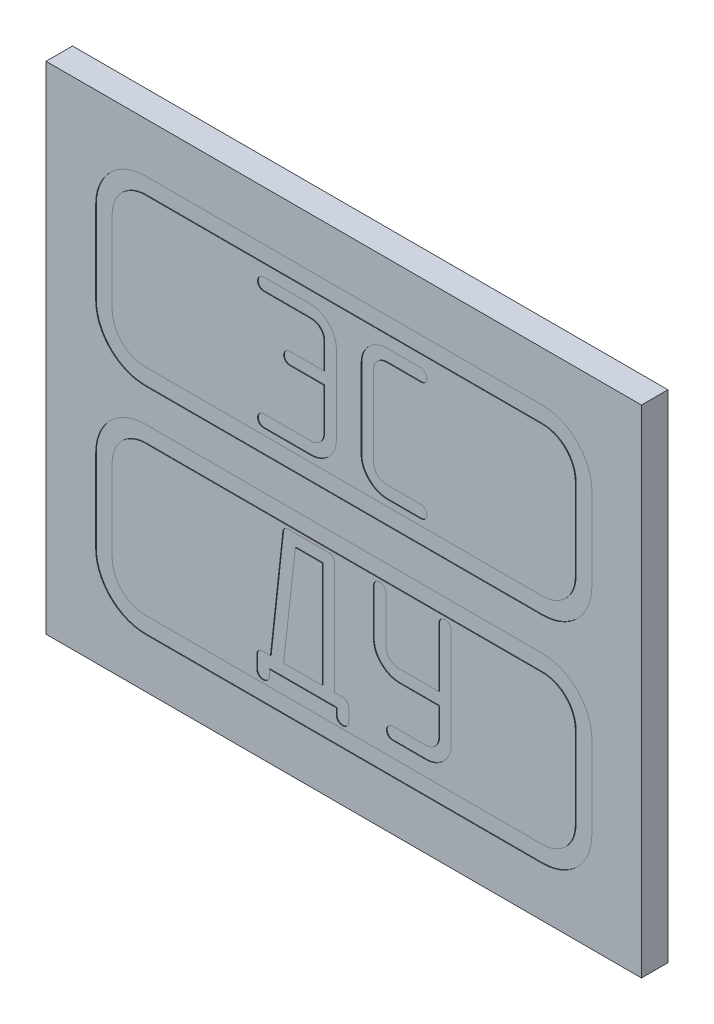
from build123d import *

# Parameters (mm, degrees)
SKETCH_1_W               = 18
SKETCH_1_H               = 15
EXTRUDE_1_DEPTH          = 0.8
CUT_EXTRUDE_1_DEPTH      = 0.02
CUT_EXTRUDE_1_DEPTH_BACK = 0.02
CUT_EXTRUDE_1_2_DEPTH    = 0.02
CUT_EXTRUDE_2_DEPTH      = 0.02
CUT_EXTRUDE_2_DEPTH_BACK = 0.02


with BuildPart() as part:
    # Эскиз1 → Вытянуть1 (new body)
    with BuildSketch(Plane.XY):
        Rectangle(SKETCH_1_W, SKETCH_1_H)
    extrude(amount=EXTRUDE_1_DEPTH)

    # Эскиз2 → Cut-Extrude 1 (cut, two sides: drawn at the far end of the back side and taken through both)
    with BuildSketch(Plane.XY.offset(0.8).offset(-CUT_EXTRUDE_1_DEPTH_BACK)):
        with BuildLine():
            Line((-6, 0.5), (6, 0.5))
            ThreePointArc((6, 0.5), (7.060660172, 0.939339828), (7.5, 2))
            Line((7.5, 2), (7.5, 4.5))
            ThreePointArc((7.5, 4.5), (7.060660172, 5.560660172), (6, 6))
            Line((6, 6), (-6, 6))
            ThreePointArc((-6, 6), (-7.060660172, 5.560660172), (-7.5, 4.5))
            Line((-7.5, 4.5), (-7.5, 2))
            ThreePointArc((-7.5, 2), (-7.060660172, 0.939339828), (-6, 0.5))
        make_face()
        with BuildLine():
            Line((-6, 1), (6, 1))
            ThreePointArc((6, 1), (6.707106781, 1.292893219), (7, 2))
            Line((7, 2), (7, 4.5))
            ThreePointArc((7, 4.5), (6.707106781, 5.207106781), (6, 5.5))
            Line((6, 5.5), (-6, 5.5))
            ThreePointArc((-6, 5.5), (-6.707106781, 5.207106781), (-7, 4.5))
            Line((-7, 4.5), (-7, 2))
            ThreePointArc((-7, 2), (-6.707106781, 1.292893219), (-6, 1))
        make_face(mode=Mode.SUBTRACT)
    extrude(amount=CUT_EXTRUDE_1_DEPTH + CUT_EXTRUDE_1_DEPTH_BACK, mode=Mode.SUBTRACT)

    # Эскиз3 → Cut-Extrude 1 2 (cut)
    # profile 1 of 4: a face of its own
    with BuildSketch(Plane.XY.offset(0.8)):
        with BuildLine():
            Line((-0.596889332, 3.219193213), (-1.613204885, 3.219193213))
            add(Edge.make_bspline(
                [(-1.613204885, 3.219193213), (-1.628016986, 3.219769033), (-1.656617464, 3.220880877), (-1.697276231, 3.231283891), (-1.734108901, 3.247558142), (-1.754265382, 3.264310727), (-1.764233716, 3.272595672)],
                knots=[0, 0, 0, 0, 1.082212763, 2.089629431, 3.055231423, 4, 4, 4, 4], degree=3))
            add(Edge.make_bspline(
                [(-1.764233716, 3.272595672), (-1.772554484, 3.281977132), (-1.788928726, 3.300438686), (-1.804043843, 3.333935298), (-1.815181196, 3.36894989), (-1.816251598, 3.393489156), (-1.816801761, 3.40610182)],
                knots=[0, 0, 0, 0, 1.018092641, 2.003480347, 2.973831138, 4, 4, 4, 4], degree=3))
            add(Edge.make_bspline(
                [(-1.816801761, 3.40610182), (-1.816191209, 3.417313547), (-1.814975416, 3.439639445), (-1.803932273, 3.472366144), (-1.787324337, 3.504139918), (-1.763691451, 3.53412065), (-1.734610026, 3.561092607), (-1.69805972, 3.579291903), (-1.657418954, 3.591818992), (-1.6283291, 3.592602876), (-1.613204885, 3.593010428)],
                knots=[0, 0, 0, 0, 0.873130029, 1.738662759, 2.671355733, 3.661936551, 4.708106496, 5.737914824, 6.823910888, 8, 8, 8, 8], degree=3))
            Line((-1.613204885, 3.593010428), (-0.596889332, 3.593010428))
            Line((-0.596889332, 3.593010428), (-0.596889332, 4.376524635))
            add(Edge.make_bspline(
                [(-0.596889332, 4.376524635), (-0.597928503, 4.403125049), (-0.599957421, 4.455060742), (-0.623042956, 4.528957652), (-0.658603451, 4.59687019), (-0.708961696, 4.656103976), (-0.768907915, 4.706402137), (-0.838827361, 4.742061594), (-0.915885534, 4.764820489), (-0.970262082, 4.766830339), (-0.99824219, 4.767864532)],
                knots=[0, 0, 0, 0, 1.016882502, 1.985401296, 2.939719901, 3.939395027, 4.947287343, 5.920493491, 6.929964869, 8, 8, 8, 8], degree=3))
            Line((-0.99824219, 4.767864532), (-2.404228814, 4.767864532))
            add(Edge.make_bspline(
                [(-2.404228814, 4.767864532), (-2.418739765, 4.768549355), (-2.446952192, 4.7698808), (-2.487202369, 4.778873053), (-2.523550643, 4.794780261), (-2.543597454, 4.81078631), (-2.553588817, 4.818763751)],
                knots=[0, 0, 0, 0, 1.079228925, 2.098254295, 3.052166909, 4, 4, 4, 4], degree=3))
            add(Edge.make_bspline(
                [(-2.553588817, 4.818763751), (-2.561493266, 4.829083781), (-2.576753882, 4.849008005), (-2.592865128, 4.882741691), (-2.603477962, 4.917969492), (-2.604705288, 4.94245873), (-2.605322449, 4.954773139)],
                knots=[0, 0, 0, 0, 1.048365217, 2.024011849, 3.006374687, 4, 4, 4, 4], degree=3))
            add(Edge.make_bspline(
                [(-2.605322449, 4.954773139), (-2.60257123, 4.976325175), (-2.596762409, 5.021829343), (-2.564869213, 5.073213731), (-2.528476493, 5.107882581), (-2.493705503, 5.128786193), (-2.451797974, 5.139165321), (-2.422355509, 5.140809352), (-2.406732054, 5.141681747)],
                knots=[0, 0, 0, 0, 1.277933993, 2.698182411, 3.46842026, 4.252142893, 5.072510809, 6, 6, 6, 6], degree=3))
            Line((-2.406732054, 5.141681747), (-1.017433699, 5.141681747))
            add(Edge.make_bspline(
                [(-1.017433699, 5.141681747), (-0.990140432, 5.141132105), (-0.936716344, 5.14005623), (-0.858119915, 5.128868408), (-0.782887824, 5.110124833), (-0.709823906, 5.085961263), (-0.641449169, 5.051233349), (-0.574533198, 5.012633382), (-0.512290535, 4.964395039), (-0.453423227, 4.91052403), (-0.399324724, 4.8519555), (-0.352718493, 4.788925398), (-0.312007772, 4.723711534), (-0.279491321, 4.655048623), (-0.25434925, 4.583387561), (-0.235849748, 4.508855188), (-0.224775684, 4.431096504), (-0.223644298, 4.378229113), (-0.223072117, 4.351492232)],
                knots=[0, 0, 0, 0, 1.050167734, 2.055607787, 3.047617647, 4.032960115, 5.009831009, 5.99406756, 7.002695157, 8.033359574, 9.064023991, 10.066209167, 11.046828262, 12.019052546, 12.984175888, 13.965788192, 14.971228244, 16, 16, 16, 16], degree=3))
            Line((-0.223072117, 4.351492232), (-0.223072117, 1.980089274))
            add(Edge.make_bspline(
                [(-0.223072117, 1.980089274), (-0.223628414, 1.953349814), (-0.224722657, 1.900752909), (-0.235897627, 1.823569108), (-0.25426088, 1.749442889), (-0.280495301, 1.678349229), (-0.313062078, 1.609420038), (-0.353199387, 1.543325092), (-0.401112793, 1.480752328), (-0.455041827, 1.421869273), (-0.513925115, 1.367941641), (-0.576495603, 1.320022549), (-0.642599176, 1.279906014), (-0.711733417, 1.247151262), (-0.783713134, 1.22095722), (-0.859001688, 1.202837747), (-0.937262297, 1.191531959), (-0.990415058, 1.190449829), (-1.017433699, 1.18989976)],
                knots=[0, 0, 0, 0, 1.029941063, 2.025908974, 2.998234343, 3.968074909, 4.941404228, 5.932282965, 6.942056974, 7.973892849, 9.005728724, 10.015502733, 11.00638147, 11.979710789, 12.959628657, 13.952766041, 14.959348882, 16, 16, 16, 16], degree=3))
            Line((-1.017433699, 1.18989976), (-2.406732054, 1.18989976))
            add(Edge.make_bspline(
                [(-2.406732054, 1.18989976), (-2.421258768, 1.190491143), (-2.44929668, 1.191632567), (-2.489008847, 1.201755271), (-2.52460489, 1.218760267), (-2.544427598, 1.235075325), (-2.55442323, 1.243302219)],
                knots=[0, 0, 0, 0, 1.08270052, 2.08971301, 3.036734717, 4, 4, 4, 4], degree=3))
            add(Edge.make_bspline(
                [(-2.55442323, 1.243302219), (-2.562384548, 1.252733893), (-2.578159128, 1.271421843), (-2.593682396, 1.304468135), (-2.603422143, 1.339816042), (-2.604676005, 1.364224351), (-2.605322449, 1.376808367)],
                knots=[0, 0, 0, 0, 1.009147664, 1.999528548, 2.968631313, 4, 4, 4, 4], degree=3))
            add(Edge.make_bspline(
                [(-2.605322449, 1.376808367), (-2.604730193, 1.388029856), (-2.603550834, 1.410375193), (-2.592271289, 1.44283241), (-2.576898153, 1.475118788), (-2.552974229, 1.504483808), (-2.524785016, 1.532083924), (-2.488426083, 1.5497684), (-2.448217048, 1.562652457), (-2.419367511, 1.563350617), (-2.404228814, 1.563716975)],
                knots=[0, 0, 0, 0, 0.878276967, 1.748911851, 2.677128637, 3.673548744, 4.709657974, 5.74553683, 6.816978063, 8, 8, 8, 8], degree=3))
            Line((-2.404228814, 1.563716975), (-0.99824219, 1.563716975))
            add(Edge.make_bspline(
                [(-0.99824219, 1.563716975), (-0.971388219, 1.565153844), (-0.918711017, 1.567972432), (-0.843111112, 1.590436188), (-0.774046879, 1.627232899), (-0.712622939, 1.677371408), (-0.660314801, 1.738667361), (-0.623398065, 1.811019566), (-0.600878084, 1.891701147), (-0.598252794, 1.948228284), (-0.596889332, 1.977586034)],
                knots=[0, 0, 0, 0, 1.000109959, 1.961832511, 2.913037971, 3.901189575, 4.902535864, 5.895303883, 6.906911888, 8, 8, 8, 8], degree=3))
            Line((-0.596889332, 1.977586034), (-0.596889332, 3.219193213))
        make_face()
    # profile 2 of 4: a face of its own
    with BuildSketch(Plane.XY.offset(0.8)):
        with BuildLine():
            Line((2.316882353, 1.18989976), (1.321427135, 1.18989976))
            add(Edge.make_bspline(
                [(1.321427135, 1.18989976), (1.294687055, 1.19045291), (1.24208893, 1.191540965), (1.164646213, 1.20279975), (1.090323988, 1.221077819), (1.018730097, 1.246700825), (0.949008841, 1.277782756), (0.883172291, 1.318732063), (0.819591342, 1.365322098), (0.759645838, 1.418540304), (0.705191275, 1.477444387), (0.656495974, 1.539583084), (0.616219989, 1.605638694), (0.582491234, 1.674174777), (0.556437794, 1.746385844), (0.538598185, 1.821730482), (0.525912344, 1.89983813), (0.525017061, 1.953057239), (0.524562313, 1.980089274)],
                knots=[0, 0, 0, 0, 1.028286897, 2.022655204, 3.003804875, 3.968473356, 4.945411562, 5.93469887, 6.945007337, 7.975963957, 9.013399247, 10.028062878, 11.008219808, 11.984630304, 12.962974347, 13.954516674, 14.96102025, 16, 16, 16, 16], degree=3))
            Line((0.524562313, 1.980089274), (0.524562313, 4.351492232))
            add(Edge.make_bspline(
                [(0.524562313, 4.351492232), (0.525112583, 4.378510741), (0.526195109, 4.431663242), (0.537498021, 4.509925742), (0.55562816, 4.585207286), (0.581783042, 4.657212738), (0.614518983, 4.725906051), (0.653723372, 4.791880083), (0.702079038, 4.85338493), (0.755709195, 4.912175734), (0.814414776, 4.966449264), (0.877919597, 5.013041498), (0.944318649, 5.052345008), (1.013233289, 5.085732441), (1.086011072, 5.110189704), (1.161552625, 5.128945638), (1.240438035, 5.140005712), (1.294135173, 5.141116951), (1.321427135, 5.141681747)],
                knots=[0, 0, 0, 0, 1.037183757, 2.040412751, 3.030241086, 4.006893952, 4.976980221, 5.949886173, 6.947810811, 7.976208698, 9.004606584, 10.01316862, 10.99524074, 11.965327009, 12.948502614, 13.93833095, 14.952141686, 16, 16, 16, 16], degree=3))
            Line((1.321427135, 5.141681747), (2.316882353, 5.141681747))
            add(Edge.make_bspline(
                [(2.316882353, 5.141681747), (2.330308263, 5.141139866), (2.356522856, 5.140081824), (2.394182992, 5.128815134), (2.428090302, 5.10972525), (2.458725144, 5.085006889), (2.483842766, 5.055661029), (2.503218926, 5.024065756), (2.514562514, 4.990021621), (2.515725012, 4.966534766), (2.516307162, 4.954773139)],
                knots=[0, 0, 0, 0, 1.064052253, 2.077601868, 3.0860831, 4.13837496, 5.187880517, 6.138828305, 7.06797199, 8, 8, 8, 8], degree=3))
            add(Edge.make_bspline(
                [(2.516307162, 4.954773139), (2.513633157, 4.933164116), (2.507922122, 4.88701242), (2.474314082, 4.836092878), (2.43805742, 4.800686541), (2.402517623, 4.780779968), (2.360293687, 4.770353857), (2.330288602, 4.768727088), (2.314379113, 4.767864532)],
                knots=[0, 0, 0, 0, 1.266254501, 2.704416213, 3.467614585, 4.236046379, 5.064705186, 6, 6, 6, 6], degree=3))
            Line((2.314379113, 4.767864532), (1.30307004, 4.767864532))
            add(Edge.make_bspline(
                [(1.30307004, 4.767864532), (1.275683089, 4.76633662), (1.222033689, 4.763343532), (1.144823453, 4.742291863), (1.074339007, 4.705575583), (1.034597723, 4.671102338), (1.014362994, 4.653549892)],
                knots=[0, 0, 0, 0, 1.032059628, 2.021743112, 2.992747939, 4, 4, 4, 4], degree=3))
            add(Edge.make_bspline(
                [(1.014362994, 4.653549892), (0.996490977, 4.633636038), (0.961112116, 4.594215225), (0.924210632, 4.523675294), (0.902955636, 4.447009429), (0.899920954, 4.394180063), (0.898379528, 4.367346087)],
                knots=[0, 0, 0, 0, 1.010358544, 2.000072701, 2.984163436, 4, 4, 4, 4], degree=3))
            Line((0.898379528, 4.367346087), (0.898379528, 1.964235419))
            add(Edge.make_bspline(
                [(0.898379528, 1.964235419), (0.899800672, 1.937090513), (0.902588452, 1.883841818), (0.925271464, 1.807629937), (0.961161409, 1.736993502), (0.9964227, 1.69791436), (1.014362994, 1.678031614)],
                knots=[0, 0, 0, 0, 1.026550069, 2.013727771, 2.989421339, 4, 4, 4, 4], degree=3))
            add(Edge.make_bspline(
                [(1.014362994, 1.678031614), (1.034755166, 1.661472231), (1.075123939, 1.628690927), (1.120996774, 1.604204305), (1.143697075, 1.592087031)],
                knots=[0, 0, 0, 0, 1.010294363, 2, 2, 2, 2], degree=3))
            add(Edge.make_bspline(
                [(1.143697075, 1.592087031), (1.171320936, 1.584038875), (1.22345094, 1.568850903), (1.277610029, 1.565358665), (1.30307004, 1.563716975)],
                knots=[0, 0, 0, 0, 1.059806561, 2, 2, 2, 2], degree=3))
            Line((1.30307004, 1.563716975), (2.314379113, 1.563716975))
            add(Edge.make_bspline(
                [(2.314379113, 1.563716975), (2.327802835, 1.56315436), (2.354280669, 1.562044622), (2.392454839, 1.550828994), (2.427130756, 1.53202008), (2.457850905, 1.507006162), (2.48309655, 1.477731554), (2.502150137, 1.445928112), (2.514805032, 1.4122305), (2.515807199, 1.388598122), (2.516307162, 1.376808367)],
                knots=[0, 0, 0, 0, 1.057748023, 2.086371758, 3.108174774, 4.154232081, 5.197519594, 6.142833266, 7.073494011, 8, 8, 8, 8], degree=3))
            add(Edge.make_bspline(
                [(2.516307162, 1.376808367), (2.51359909, 1.355210831), (2.50783343, 1.309228275), (2.475003668, 1.258412588), (2.439670941, 1.222482326), (2.404150684, 1.202855024), (2.362244236, 1.19244865), (2.332515304, 1.190778177), (2.316882353, 1.18989976)],
                knots=[0, 0, 0, 0, 1.274021799, 2.712475087, 3.468462899, 4.24160831, 5.075350171, 6, 6, 6, 6], degree=3))
        make_face()
    # profile 3 of 4: a face of its own
    with BuildSketch(Plane.XY.offset(0.8)):
        with BuildLine():
            Line((-2.214816966, -4.666379559), (-1.842668578, -1.253628645))
            add(Edge.make_bspline(
                [(-1.842668578, -1.253628645), (-1.842012575, -1.240777561), (-1.840753473, -1.216111752), (-1.831711837, -1.181638089), (-1.816408528, -1.151870576), (-1.794243581, -1.128263708), (-1.765846734, -1.10998247), (-1.731803204, -1.097004354), (-1.691395301, -1.089599578), (-1.662746207, -1.088827782), (-1.647415836, -1.088414787)],
                knots=[0, 0, 0, 0, 1.053810548, 2.022637772, 2.900648452, 3.772706449, 4.646256419, 5.650718974, 6.742880019, 8, 8, 8, 8], degree=3))
            Line((-1.647415836, -1.088414787), (-0.472561731, -1.088414787))
            add(Edge.make_bspline(
                [(-0.472561731, -1.088414787), (-0.457212495, -1.089045226), (-0.42815651, -1.090238641), (-0.387680167, -1.099294128), (-0.352896209, -1.114334184), (-0.32448625, -1.136756144), (-0.302377694, -1.165730771), (-0.287509127, -1.201071941), (-0.278205901, -1.242028408), (-0.277076331, -1.271372655), (-0.276474576, -1.287005182)],
                knots=[0, 0, 0, 0, 1.151165151, 2.179146642, 3.094801823, 3.971806236, 4.865301301, 5.800032228, 6.828013719, 8, 8, 8, 8], degree=3))
            Line((-0.276474576, -1.287005182), (-0.276474576, -4.666379559))
            Line((-0.276474576, -4.666379559), (-0.062864739, -4.666379559))
            add(Edge.make_bspline(
                [(-0.062864739, -4.666379559), (-0.046110074, -4.666610491), (-0.014531881, -4.667045737), (0.029199459, -4.676772674), (0.067270092, -4.690254492), (0.097727657, -4.711791885), (0.122477948, -4.738447249), (0.138814207, -4.77182537), (0.149256224, -4.81066436), (0.150227451, -4.83846886), (0.150745098, -4.853288167)],
                knots=[0, 0, 0, 0, 1.23372879, 2.325258308, 3.293962694, 4.194060993, 5.051935919, 5.952034218, 6.908470482, 8, 8, 8, 8], degree=3))
            Line((0.150745098, -4.853288167), (0.150745098, -5.227105382))
            add(Edge.make_bspline(
                [(0.150745098, -5.227105382), (0.150214534, -5.239706328), (0.149178841, -5.264304131), (0.137661895, -5.299697979), (0.118689619, -5.33163478), (0.094289842, -5.360797288), (0.064162613, -5.383144549), (0.033116981, -5.401941575), (-0.001068483, -5.412045858), (-0.024425398, -5.413355715), (-0.036163509, -5.414013989)],
                knots=[0, 0, 0, 0, 1.031748002, 2.014034101, 3.016814067, 4.069579463, 5.111138284, 6.082747043, 7.036476891, 8, 8, 8, 8], degree=3))
            add(Edge.make_bspline(
                [(-0.036163509, -5.414013989), (-0.057675706, -5.411483624), (-0.103116524, -5.406138662), (-0.154765548, -5.375999375), (-0.189887084, -5.34178887), (-0.210195965, -5.30874854), (-0.220439492, -5.269412612), (-0.222169, -5.241618799), (-0.223072117, -5.227105382)],
                knots=[0, 0, 0, 0, 1.313694866, 2.774954664, 3.544261478, 4.299350482, 5.111952142, 6, 6, 6, 6], degree=3))
            Line((-0.223072117, -5.227105382), (-0.223072117, -5.040196774))
            Line((-0.223072117, -5.040196774), (-2.25236557, -5.040196774))
            Line((-2.25236557, -5.040196774), (-2.25236557, -5.227105382))
            add(Edge.make_bspline(
                [(-2.25236557, -5.227105382), (-2.252896134, -5.239706328), (-2.253931827, -5.264304131), (-2.265448773, -5.299697979), (-2.284421049, -5.33163478), (-2.308820826, -5.360797288), (-2.338948055, -5.383144549), (-2.369993687, -5.401941575), (-2.404179151, -5.412045858), (-2.427536066, -5.413355715), (-2.439274177, -5.414013989)],
                knots=[0, 0, 0, 0, 1.031748002, 2.014034101, 3.016814067, 4.069579463, 5.111138284, 6.082747043, 7.036476891, 8, 8, 8, 8], degree=3))
            add(Edge.make_bspline(
                [(-2.439274177, -5.414013989), (-2.460786374, -5.411483624), (-2.506227192, -5.406138662), (-2.557876216, -5.375999375), (-2.592997752, -5.34178887), (-2.613306633, -5.30874854), (-2.62355016, -5.269412612), (-2.625279668, -5.241618799), (-2.626182785, -5.227105382)],
                knots=[0, 0, 0, 0, 1.313694866, 2.774954664, 3.544261478, 4.299350482, 5.111952142, 6, 6, 6, 6], degree=3))
            Line((-2.626182785, -5.227105382), (-2.626182785, -4.853288167))
            add(Edge.make_bspline(
                [(-2.626182785, -4.853288167), (-2.6256035, -4.838476574), (-2.624519324, -4.810755543), (-2.614943525, -4.77212216), (-2.600552228, -4.738593484), (-2.577517838, -4.712118448), (-2.549757976, -4.690478403), (-2.514753641, -4.67669633), (-2.474564153, -4.667099214), (-2.445461279, -4.666628229), (-2.43009563, -4.666379559)],
                knots=[0, 0, 0, 0, 1.142786369, 2.138812389, 3.062348774, 3.932270476, 4.822416454, 5.756900313, 6.815694862, 8, 8, 8, 8], degree=3))
            Line((-2.43009563, -4.666379559), (-2.214816966, -4.666379559))
        make_face()
        Polygon((-0.650291791, -4.666379559), (-0.650291791, -1.462232002), (-1.462176055, -1.462232002), (-1.818470588, -4.666379559), align=None, mode=Mode.SUBTRACT)
    # profile 4 of 4: a face of its own
    with BuildSketch(Plane.XY.offset(0.8)):
        with BuildLine():
            Line((2.874270522, -3.438122996), (1.688569043, -3.438122996))
            add(Edge.make_bspline(
                [(1.688569043, -3.438122996), (1.662102217, -3.437591289), (1.610048239, -3.436545549), (1.533564548, -3.424992621), (1.459644472, -3.40779725), (1.388336824, -3.382521672), (1.319923166, -3.34991837), (1.254445651, -3.310245955), (1.191390086, -3.264157956), (1.132110513, -3.211135361), (1.077286428, -3.153386204), (1.029299521, -3.091402739), (0.989484258, -3.025875934), (0.955223282, -2.958232089), (0.930522051, -2.886462705), (0.912239092, -2.811905745), (0.899807218, -2.734290637), (0.898858809, -2.681358292), (0.898379528, -2.654608788)],
                knots=[0, 0, 0, 0, 1.026333242, 2.018554473, 2.995093272, 3.968046237, 4.948157751, 5.931118087, 6.935012911, 7.974823293, 9.013288221, 10.021525797, 11.010100225, 11.985206272, 12.958159238, 13.947734932, 14.962882269, 16, 16, 16, 16], degree=3))
            Line((0.898379528, -2.654608788), (0.898379528, -1.284501942))
            add(Edge.make_bspline(
                [(0.898379528, -1.284501942), (0.898954981, -1.271624197), (0.900114196, -1.245682801), (0.91177233, -1.207932778), (0.929245077, -1.171386832), (0.945805364, -1.149623651), (0.954285228, -1.138479593)],
                knots=[0, 0, 0, 0, 0.966544804, 1.947042782, 2.94876229, 4, 4, 4, 4], degree=3))
            add(Edge.make_bspline(
                [(0.954285228, -1.138479593), (0.963773436, -1.130881238), (0.982507172, -1.115878872), (1.014542811, -1.100003311), (1.049129231, -1.090328183), (1.072984868, -1.089065831), (1.085288136, -1.088414787)],
                knots=[0, 0, 0, 0, 1.015427485, 2.004883423, 2.971041728, 4, 4, 4, 4], degree=3))
            add(Edge.make_bspline(
                [(1.085288136, -1.088414787), (1.097027617, -1.089108658), (1.120310382, -1.090484805), (1.154026565, -1.099907642), (1.185852669, -1.115583761), (1.215483633, -1.13670231), (1.241336678, -1.164651803), (1.259727231, -1.199683081), (1.270831482, -1.241003702), (1.271723641, -1.270519095), (1.272196743, -1.286170769)],
                knots=[0, 0, 0, 0, 0.921612733, 1.827822837, 2.726630868, 3.696675955, 4.670893298, 5.687299756, 6.773601616, 8, 8, 8, 8], degree=3))
            Line((1.272196743, -1.286170769), (1.272196743, -2.668793817))
            add(Edge.make_bspline(
                [(1.272196743, -2.668793817), (1.273711385, -2.695633728), (1.276678204, -2.748206679), (1.29798981, -2.823935757), (1.334291117, -2.893291652), (1.368931775, -2.93201066), (1.386511383, -2.951659968)],
                knots=[0, 0, 0, 0, 1.028312002, 2.014216694, 2.992245141, 4, 4, 4, 4], degree=3))
            add(Edge.make_bspline(
                [(1.386511383, -2.951659968), (1.406925094, -2.967918015), (1.44716744, -2.999968138), (1.492616773, -3.0240633), (1.51501105, -3.035935724)],
                knots=[0, 0, 0, 0, 1.01453881, 2, 2, 2, 2], degree=3))
            add(Edge.make_bspline(
                [(1.51501105, -3.035935724), (1.54235488, -3.043983532), (1.593920358, -3.05916023), (1.647532274, -3.062661257), (1.672715188, -3.064305781)],
                knots=[0, 0, 0, 0, 1.06054792, 2, 2, 2, 2], degree=3))
            Line((1.672715188, -3.064305781), (2.874270522, -3.064305781))
            Line((2.874270522, -3.064305781), (2.874270522, -1.286170769))
            add(Edge.make_bspline(
                [(2.874270522, -1.286170769), (2.874822458, -1.27301168), (2.875922473, -1.246785495), (2.887663395, -1.208766842), (2.905136052, -1.172221338), (2.921696351, -1.150458096), (2.930176221, -1.139314006)],
                knots=[0, 0, 0, 0, 0.982279067, 1.957691288, 2.954214966, 4, 4, 4, 4], degree=3))
            add(Edge.make_bspline(
                [(2.930176221, -1.139314006), (2.939622657, -1.131381506), (2.958148224, -1.115824946), (2.990458863, -1.100036185), (3.02501355, -1.090319426), (3.04887359, -1.089062851), (3.061179129, -1.088414787)],
                knots=[0, 0, 0, 0, 1.025879868, 2.011870596, 2.974645281, 4, 4, 4, 4], degree=3))
            add(Edge.make_bspline(
                [(3.061179129, -1.088414787), (3.072918611, -1.089108658), (3.096201376, -1.090484805), (3.129917559, -1.099907642), (3.161743663, -1.115583761), (3.191374626, -1.13670231), (3.217227672, -1.164651803), (3.235618225, -1.199683081), (3.246722476, -1.241003702), (3.247614635, -1.270519095), (3.248087737, -1.286170769)],
                knots=[0, 0, 0, 0, 0.921612733, 1.827822837, 2.726630868, 3.696675955, 4.670893298, 5.687299756, 6.773601616, 8, 8, 8, 8], degree=3))
            Line((3.248087737, -1.286170769), (3.248087737, -4.25000726))
            add(Edge.make_bspline(
                [(3.248087737, -4.25000726), (3.247526594, -4.276745181), (3.246422818, -4.329339061), (3.235316991, -4.40654481), (3.216721979, -4.480498944), (3.191517161, -4.551696553), (3.159928964, -4.620901461), (3.119513131, -4.686491106), (3.072637812, -4.749365175), (3.019456649, -4.808197741), (2.961426312, -4.862138654), (2.899685321, -4.91004868), (2.834427089, -4.950202343), (2.766319627, -4.982736839), (2.695589572, -5.009308316), (2.621333767, -5.027228609), (2.54419298, -5.038533056), (2.491870956, -5.03963795), (2.465407943, -5.040196774)],
                knots=[0, 0, 0, 0, 1.037699588, 2.041170104, 3.02081998, 3.994318803, 4.970390255, 5.968733261, 6.979615547, 8.011962211, 9.04363074, 10.05243397, 11.041563021, 12.012482399, 12.979489555, 13.969620435, 14.973090951, 16, 16, 16, 16], degree=3))
            Line((2.465407943, -5.040196774), (1.487475407, -5.040196774))
            add(Edge.make_bspline(
                [(1.487475407, -5.040196774), (1.473219181, -5.039619289), (1.445714754, -5.038505151), (1.406660096, -5.028139634), (1.371379252, -5.011563614), (1.351983954, -4.995050087), (1.342287471, -4.986794315)],
                knots=[0, 0, 0, 0, 1.077429077, 2.078675667, 3.03945327, 4, 4, 4, 4], degree=3))
            add(Edge.make_bspline(
                [(1.342287471, -4.986794315), (1.334660443, -4.977320902), (1.319444597, -4.958421538), (1.303828852, -4.925654253), (1.294131994, -4.890273604), (1.292872179, -4.86586984), (1.292222665, -4.853288167)],
                knots=[0, 0, 0, 0, 0.998808508, 1.992613065, 2.965065947, 4, 4, 4, 4], degree=3))
            add(Edge.make_bspline(
                [(1.292222665, -4.853288167), (1.292818447, -4.842069559), (1.294004828, -4.81972996), (1.305230918, -4.787229057), (1.32075126, -4.755275777), (1.343618365, -4.72527585), (1.3717405, -4.698621157), (1.406915237, -4.679874231), (1.44660502, -4.667610617), (1.475138256, -4.666800769), (1.489978647, -4.666379559)],
                knots=[0, 0, 0, 0, 0.886426588, 1.765140182, 2.701969987, 3.694250836, 4.73997423, 5.746606742, 6.827989987, 8, 8, 8, 8], degree=3))
            Line((1.489978647, -4.666379559), (2.478758558, -4.666379559))
            add(Edge.make_bspline(
                [(2.478758558, -4.666379559), (2.505025383, -4.664826315), (2.556739115, -4.661768312), (2.631607163, -4.640772737), (2.699322329, -4.603497347), (2.760565906, -4.554458534), (2.811201436, -4.493269067), (2.848027678, -4.421877727), (2.870178239, -4.341984302), (2.872875881, -4.285753207), (2.874270522, -4.256682567)],
                knots=[0, 0, 0, 0, 0.991527422, 1.952104304, 2.905769643, 3.891330169, 4.898304592, 5.879829594, 6.903903422, 8, 8, 8, 8], degree=3))
            Line((2.874270522, -4.256682567), (2.874270522, -3.438122996))
        make_face()
    extrude(amount=-CUT_EXTRUDE_1_2_DEPTH, mode=Mode.SUBTRACT)

    # Эскиз4 → Вырез-Вытянуть-Тонкостенный2 (cut, two sides: drawn at the far end of the back side and taken through both)
    with BuildSketch(Plane.XY.offset(0.8).offset(-CUT_EXTRUDE_2_DEPTH_BACK)):
        with BuildLine():
            Line((7.5, -4.5), (7.5, -2))
            ThreePointArc((7.5, -2), (7.060660172, -0.939339828), (6, -0.5))
            Line((6, -0.5), (-6, -0.5))
            ThreePointArc((-6, -0.5), (-7.060660172, -0.939339828), (-7.5, -2))
            Line((-7.5, -2), (-7.5, -4.5))
            ThreePointArc((-7.5, -4.5), (-7.060660172, -5.560660172), (-6, -6))
            Line((-6, -6), (6, -6))
            ThreePointArc((6, -6), (7.060660172, -5.560660172), (7.5, -4.5))
        make_face()
        with BuildLine():
            Line((7, -4.5), (7, -2))
            ThreePointArc((7, -2), (6.707106781, -1.292893219), (6, -1))
            Line((6, -1), (-6, -1))
            ThreePointArc((-6, -1), (-6.707106781, -1.292893219), (-7, -2))
            Line((-7, -2), (-7, -4.5))
            ThreePointArc((-7, -4.5), (-6.707106781, -5.207106781), (-6, -5.5))
            Line((-6, -5.5), (6, -5.5))
            ThreePointArc((6, -5.5), (6.707106781, -5.207106781), (7, -4.5))
        make_face(mode=Mode.SUBTRACT)
    extrude(amount=CUT_EXTRUDE_2_DEPTH + CUT_EXTRUDE_2_DEPTH_BACK, mode=Mode.SUBTRACT)


solid = part.part
